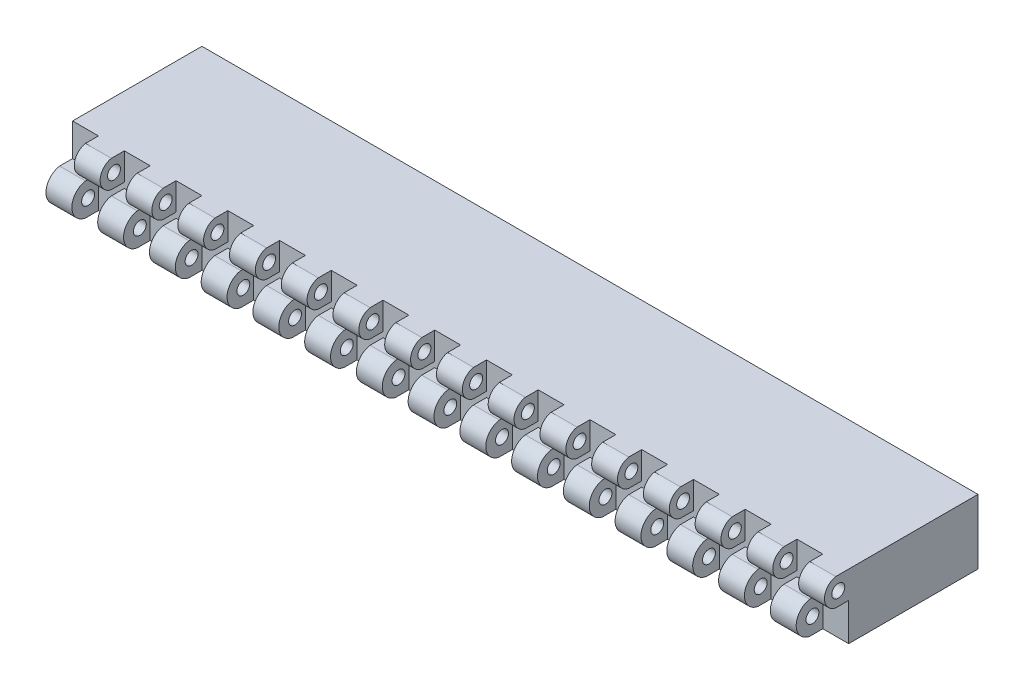
from build123d import *

# Parameters (mm, degrees)
SKETCH1_W           = 50
SKETCH1_H           = 25
BOSS_EXTRUDE1_DEPTH = 150
SKETCH2_R           = 2.5
BOSS_EXTRUDE2_DEPTH = 10
LPATTERN1_COUNT     = 15
LPATTERN1_PITCH     = 20
SKETCH3_R           = 2.5
BOSS_EXTRUDE3_DEPTH = 10
LPATTERN2_COUNT     = 15
LPATTERN2_PITCH     = 20
SKETCH4_R           = 8
CUT_EXTRUDE1_DEPTH  = 30


with BuildPart() as part:
    # Sketch1 → Boss-Extrude1 (new, symmetric)
    with BuildSketch(Plane(origin=(0, 0, 0), x_dir=(0, 0, -1), z_dir=(1, 0, 0))):
        Rectangle(SKETCH1_W, SKETCH1_H)
    extrude(amount=BOSS_EXTRUDE1_DEPTH, both=True)

    # Sketch2 → Boss-Extrude2 (add)
    with BuildSketch(Plane(origin=(150, 0, 0), x_dir=(0, 0, -1), z_dir=(1, 0, 0))):
        with BuildLine():
            Line((-25, 2), (-25, 12.5))
            Line((-25, 12.5), (-30, 12.5))
            ThreePointArc((-30, 12.5), (-34.344389582, 7.25), (-30, 2))
            Line((-30, 2), (-25, 2))
        make_face()
        with Locations((-29, 7.25)):
            Circle(SKETCH2_R, mode=Mode.SUBTRACT)
    boss_extrude2 = extrude(amount=-BOSS_EXTRUDE2_DEPTH)

    # LPattern1: Boss-Extrude2 ×15
    with Locations(*[(-i * LPATTERN1_PITCH, 0, 0) for i in range(1, LPATTERN1_COUNT)]):
        add(boss_extrude2)

    # Sketch3 → Boss-Extrude3 (add)
    with BuildSketch(Plane.ZY.offset(150)):
        with BuildLine():
            Line((25, -0.091015563), (25, -12.5))
            Line((25, -12.5), (30, -12.5))
            ThreePointArc((30, -12.5), (35.284562331, -6.295507781), (30, -0.091015563))
            Line((30, -0.091015563), (25, -0.091015563))
        make_face()
        with Locations((29, -6.295507781)):
            Circle(SKETCH3_R, mode=Mode.SUBTRACT)
    boss_extrude3 = extrude(amount=-BOSS_EXTRUDE3_DEPTH)

    # LPattern2: Boss-Extrude3 ×15
    with Locations(*[(i * LPATTERN2_PITCH, 0, 0) for i in range(1, LPATTERN2_COUNT)]):
        add(boss_extrude3)

    # Sketch4 → Cut-Extrude1 (cut)
    with BuildSketch(Plane(origin=(0, 0, -25), x_dir=(-1, 0, 0), z_dir=(0, 0, -1))):
        Circle(SKETCH4_R)
    extrude(amount=-CUT_EXTRUDE1_DEPTH, mode=Mode.SUBTRACT)


solid = part.part
